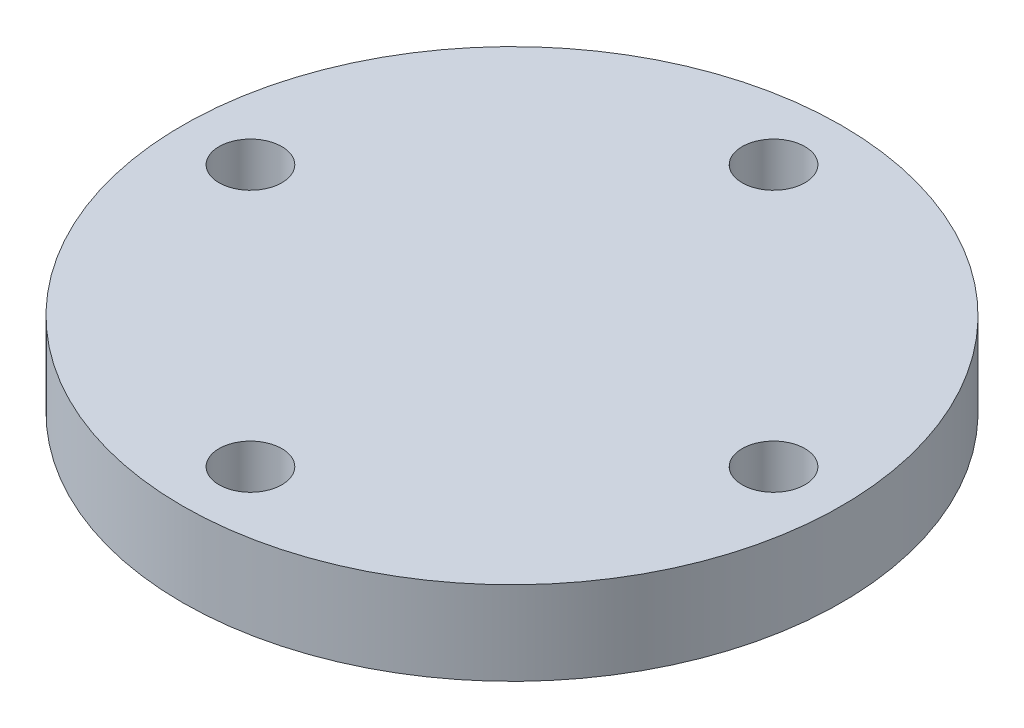
from build123d import *

# Parameters (mm, degrees)
SKETCH1_R           = 31.5
BOSS_EXTRUDE1_DEPTH = 8
SKETCH2_R           = 3
CUT_EXTRUDE1_DEPTH  = 46.260357931


with BuildPart() as part:
    # Sketch1 → Boss-Extrude1 (new body)
    with BuildSketch(Plane(origin=(0, 0, 0), x_dir=(1, 0, 0), z_dir=(0, 1, 0))):
        Circle(SKETCH1_R)
    extrude(amount=BOSS_EXTRUDE1_DEPTH)

    # Sketch2 → Cut-Extrude1 (cut, through all)
    with BuildSketch(Plane(origin=(0, 8, 0), x_dir=(1, 0, 0), z_dir=(0, 1, 0))):
        with Locations((0, 25)):
            Circle(SKETCH2_R)
        with Locations((-25, 0)):
            Circle(SKETCH2_R)
        with Locations((0, -25)):
            Circle(SKETCH2_R)
        with Locations((25, 0)):
            Circle(SKETCH2_R)
    extrude(amount=-CUT_EXTRUDE1_DEPTH, mode=Mode.SUBTRACT)


solid = part.part
